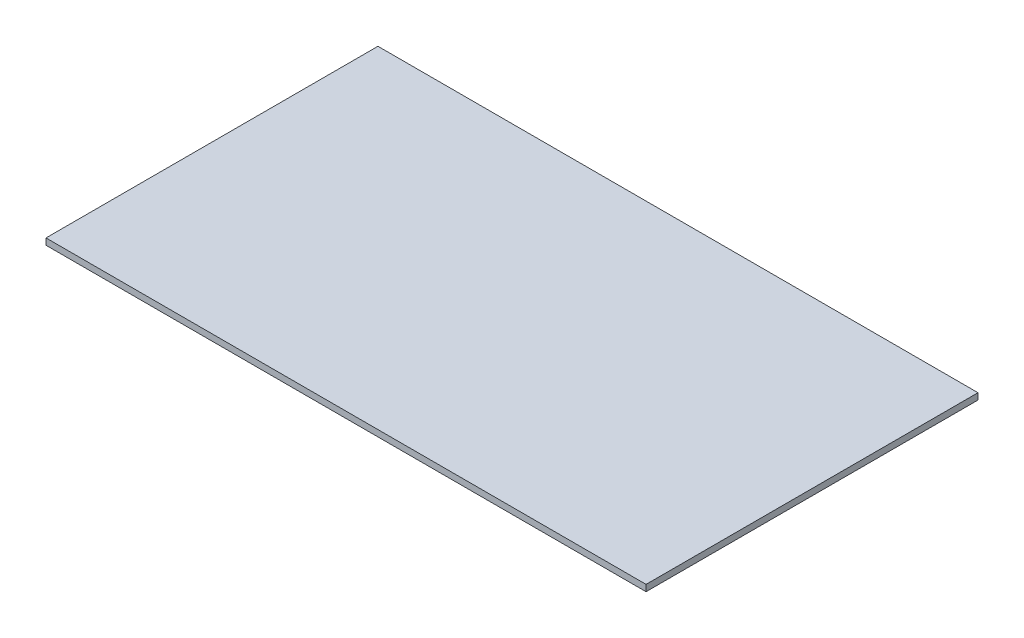
from build123d import *

# Parameters (mm, degrees)
SKETCH_1_W      = 470
SKETCH_1_H      = 260
EXTRUDE_1_DEPTH = 5


with BuildPart() as part:
    # ｽｹｯﾁ1 → ﾎﾞｽ - 押し出し1 (new body)
    with BuildSketch(Plane(origin=(0, 0, 0), x_dir=(1, 0, 0), z_dir=(0, 1, 0))):
        Rectangle(SKETCH_1_W, SKETCH_1_H)
    extrude(amount=EXTRUDE_1_DEPTH)


solid = part.part
